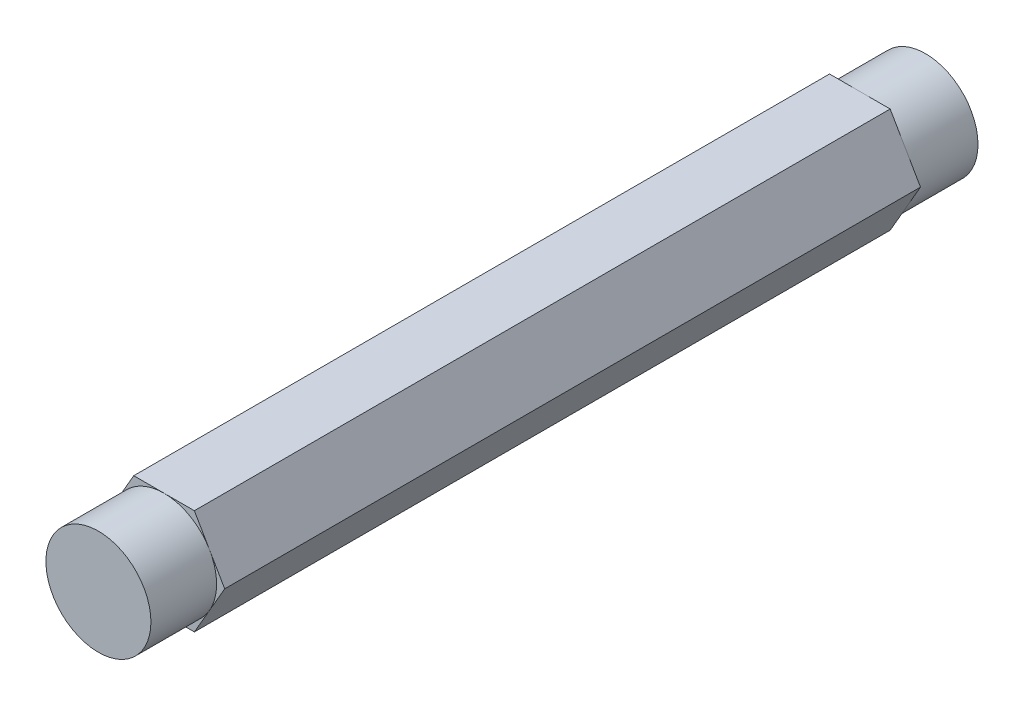
from build123d import *

# Parameters (mm, degrees)
BOSS_EXTRUDE1_DEPTH = 50.00625
SKETCH2_OUTSIDE_W   = 37.04
SKETCH2_OUTSIDE_H   = 35.076
SKETCH2_OUTSIDE_R   = 6.35
CUT_EXTRUDE1_DEPTH  = 7.9375


with BuildPart() as part:
    # Sketch1 → Boss-Extrude1 (new, symmetric)
    with BuildSketch(Plane.XY):
        Polygon((3.666174209, 6.35), (-3.666174209, 6.35), (-7.332348419, 0), (-3.666174209, -6.35), (3.666174209, -6.35), (7.332348419, 0), align=None)
    extrude(amount=BOSS_EXTRUDE1_DEPTH, both=True)

    # Sketch2 outside → Cut-Extrude1 (cut)
    with BuildSketch(Plane.XY.offset(50.00625)):
        Rectangle(SKETCH2_OUTSIDE_W, SKETCH2_OUTSIDE_H)
        Circle(SKETCH2_OUTSIDE_R, mode=Mode.SUBTRACT)
    cut_extrude1 = extrude(amount=-CUT_EXTRUDE1_DEPTH, mode=Mode.SUBTRACT)

    # Mirror1: Cut-Extrude1 across plane
    add(cut_extrude1.mirror(Plane.XY), mode=Mode.SUBTRACT)


solid = part.part
